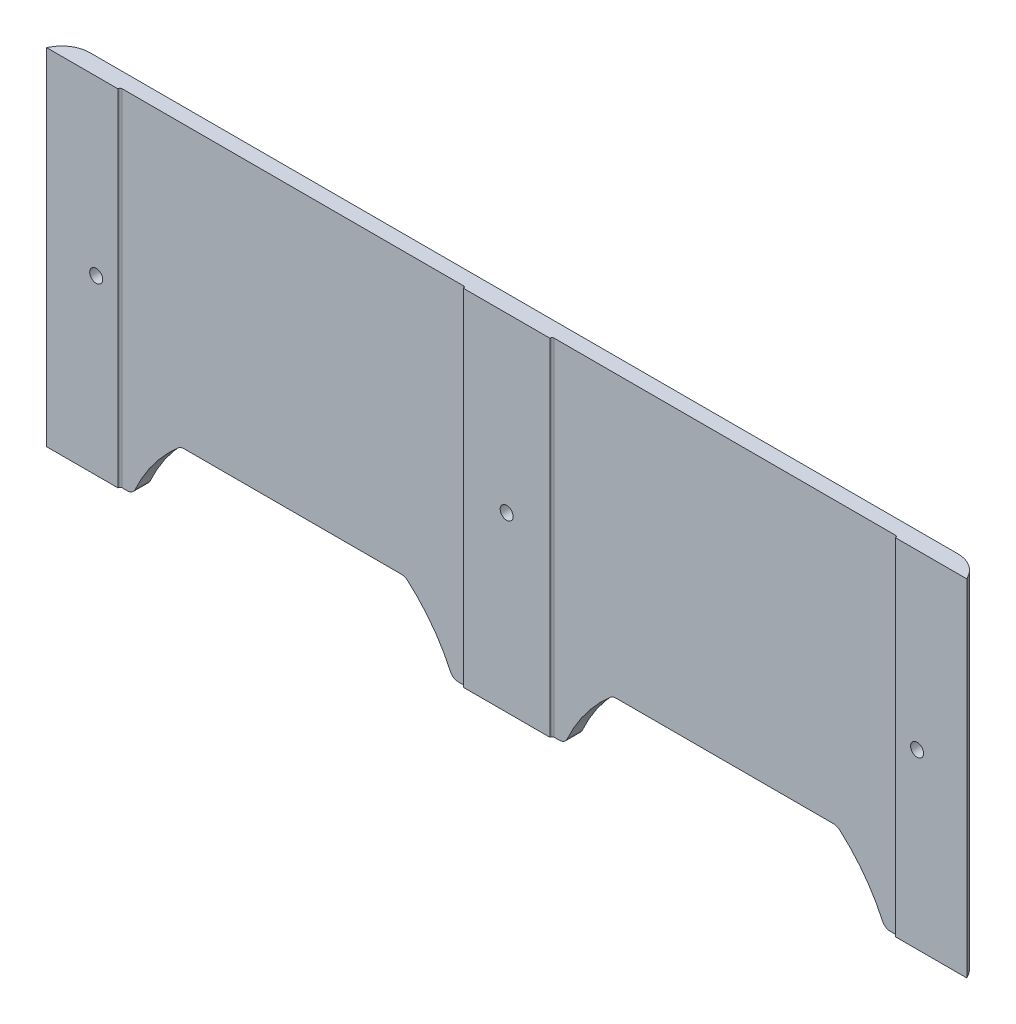
from build123d import *
from OCP.BRepFilletAPI import BRepFilletAPI_MakeChamfer

# Parameters (mm, degrees)
ESQUISSE1_W             = 213
ESQUISSE1_H             = 80
BOSS_EXTRU_1_DEPTH      = 4
CHANFREIN1_SIZE         = 4
CHANFREIN1_SIZE_2       = 2.309401077
CONG_1_R                = 6.5
ESQUISSE2_R             = 1.5
ENL_V_MAT_EXTRU_1_DEPTH = 134.260084046
ENL_V_MAT_EXTRU_2_DEPTH = 134.260084046
CHANFREIN2_SIZE         = 1.5
ENL_V_MAT_EXTRU_3_DEPTH = 134.260084046
CONG_2_R                = 2


with BuildPart() as part:
    # Esquisse1 → Boss.-Extru.1 (new body)
    with BuildSketch(Plane.XY):
        with Locations((0, -40)):
            Rectangle(ESQUISSE1_W, ESQUISSE1_H)
    extrude(amount=BOSS_EXTRU_1_DEPTH)

    # Chanfrein1
    chanfrein1_edges_1 = [part.edges().sort_by_distance(p)[0] for p in [
        (-106.5, -40, 0),
    ]]
    chanfrein1_side_1 = [part.faces().sort_by_distance(p)[0] for p in [
        (-106.5, -40, 0.046188022),
    ]]
    chanfrein1_edges_2 = [part.edges().sort_by_distance(p)[0] for p in [
        (106.5, -40, 0),
    ]]
    chanfrein1_side_2 = [part.faces().sort_by_distance(p)[0] for p in [
        (106.5, -40, 0.046188022),
    ]]
    chanfrein1 = BRepFilletAPI_MakeChamfer(part.part.solid().wrapped)
    for e in chanfrein1_edges_1:
        chanfrein1.Add(CHANFREIN1_SIZE - 0.0001, CHANFREIN1_SIZE_2 - 0.0001, e.wrapped, chanfrein1_side_1[0].wrapped)
    for e in chanfrein1_edges_2:
        chanfrein1.Add(CHANFREIN1_SIZE - 0.0001, CHANFREIN1_SIZE_2 - 0.0001, e.wrapped, chanfrein1_side_2[0].wrapped)
    add(Compound.cast(chanfrein1.Shape()), mode=Mode.REPLACE)  # a hair under: the kernel refuses the full size

    # Congé1
    cong_1_edges = [part.edges().sort_by_distance(p)[0] for p in [
        (104.190698923, -40, 0),
        (-104.190698923, -40, 0),
    ]]
    fillet(cong_1_edges, radius=CONG_1_R)

    # Esquisse2 → Enlèv. mat.-Extru.1 (cut, through all)
    with BuildSketch(Plane(origin=(0, 0, 0), x_dir=(-1, 0, 0), z_dir=(0, 0, -1))):
        with Locations((-95, -40)):
            Circle(ESQUISSE2_R)
        with Locations(Location((95, -40, 0), (0, 0, 180))):
            Circle(ESQUISSE2_R)
        with Locations((0, -40)):
            Circle(ESQUISSE2_R)
    extrude(amount=-ENL_V_MAT_EXTRU_1_DEPTH, mode=Mode.SUBTRACT)

    # Esquisse3 → Enlèv. mat.-Extru.2 (cut, through all)
    with BuildSketch(Plane(origin=(0, 0, 0), x_dir=(1, 0, 0), z_dir=(0, 1, 0))):
        with BuildLine():
            Line((-89.5, -3.5), (-10.5, -3.5))
            ThreePointArc((-10.5, -3.5), (-10, -4), (-10.5, -4.5))
            Line((-10.5, -4.5), (-89.5, -4.5))
            ThreePointArc((-89.5, -4.5), (-90, -4), (-89.5, -3.5))
        make_face()
        with BuildLine():
            Line((10.5, -3.5), (89.5, -3.5))
            ThreePointArc((89.5, -3.5), (90, -4), (89.5, -4.5))
            Line((89.5, -4.5), (10.5, -4.5))
            ThreePointArc((10.5, -4.5), (10, -4), (10.5, -3.5))
        make_face()
    extrude(amount=-ENL_V_MAT_EXTRU_2_DEPTH, mode=Mode.SUBTRACT)

    # Chanfrein2
    chanfrein2_edges = [part.edges().sort_by_distance(p)[0] for p in [
        (96.5, -40, 0),
        (-96.5, -40, 0),
        (1.5, -40, 0),
    ]]
    chamfer(chanfrein2_edges, length=CHANFREIN2_SIZE)

    # Esquisse4 → Enlèv. mat.-Extru.3 (cut, through all)
    with BuildSketch(Plane(origin=(0, 0, 0), x_dir=(-1, 0, 0), z_dir=(0, 0, -1))):
        with BuildLine():
            Line((-87, -80), (-13, -80))
            ThreePointArc((-13, -80), (-17.630306208, -71.827984304), (-24.080128411, -65))
            Line((-24.080128411, -65), (-75.919871589, -65))
            ThreePointArc((-75.919871589, -65), (-82.369693792, -71.827984304), (-87, -80))
        make_face()
        with BuildLine():
            Line((87, -80), (13, -80))
            ThreePointArc((13, -80), (17.630306208, -71.827984304), (24.080128411, -65))
            Line((24.080128411, -65), (75.919871589, -65))
            ThreePointArc((75.919871589, -65), (82.369693792, -71.827984304), (87, -80))
        make_face()
    extrude(amount=-ENL_V_MAT_EXTRU_3_DEPTH, mode=Mode.SUBTRACT)

    # Congé2
    cong_2_edges = [part.edges().sort_by_distance(p)[0] for p in [
        (87, -80, 1.75),
        (75.919871589, -65, 1.75),
        (24.080128411, -65, 1.75),
        (13, -80, 1.75),
        (-75.919871589, -65, 1.75),
        (-87, -80, 1.75),
        (-13, -80, 1.75),
        (-24.080128411, -65, 1.75),
    ]]
    fillet(cong_2_edges, radius=CONG_2_R)


solid = part.part
